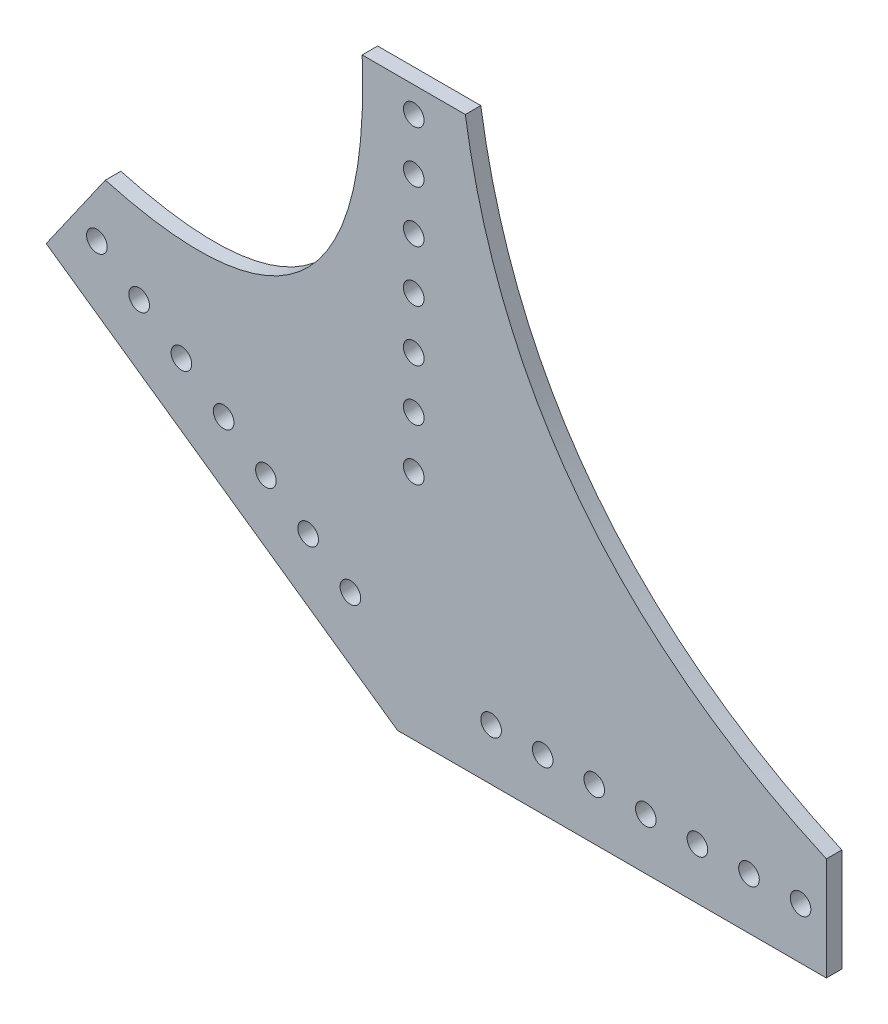
from build123d import *

# Parameters (mm, degrees)
BOSS_EXTRUDE3_DEPTH = 3.81
SKETCH1_7_R         = 2.54
CUT_EXTRUDE6_DEPTH  = 3.81


with BuildPart() as part:
    # Sketch1 → Boss-Extrude3 (new body)
    with BuildSketch(Plane.XY):
        with BuildLine():
            Line((-103.210268441, 60.572134971), (-88.641426958, 81.378596896))
            add(Edge.make_bspline(
                [(-88.641426958, 81.378596896), (-22.41304359, 63.036283333), (-25.4, 139.7)],
                knots=[0, 0, 0, 1, 1, 1], degree=2))
            Line((-25.4, 139.7), (0, 139.7))
            add(Edge.make_bspline(
                [(0, 139.7), (12.336045518, 59.79590729), (88.9, 25.4)],
                knots=[0, 0, 0, 1, 1, 1], degree=2))
            Line((88.9, 25.4), (88.9, 0))
            Line((88.9, 0), (-16.704294619, 0))
            Line((-16.704294619, 0), (-103.210268441, 60.572134971))
        make_face()
    extrude(amount=BOSS_EXTRUDE3_DEPTH)

    # Sketch1<7> → Cut-Extrude6 (cut)
    with BuildSketch(Plane.XY):
        with Locations((-12.7, 57.15)):
            Circle(SKETCH1_7_R)
        with Locations((-12.7, 69.85)):
            Circle(SKETCH1_7_R)
        with Locations((-12.7, 82.55)):
            Circle(SKETCH1_7_R)
        with Locations((-12.7, 95.25)):
            Circle(SKETCH1_7_R)
        with Locations((-12.7, 107.95)):
            Circle(SKETCH1_7_R)
        with Locations((-12.7, 120.65)):
            Circle(SKETCH1_7_R)
        with Locations((-12.7, 133.35)):
            Circle(SKETCH1_7_R)
        with Locations((6.35, 12.7)):
            Circle(SKETCH1_7_R)
        with Locations((19.05, 12.7)):
            Circle(SKETCH1_7_R)
        with Locations((31.75, 12.7)):
            Circle(SKETCH1_7_R)
        with Locations((44.45, 12.7)):
            Circle(SKETCH1_7_R)
        with Locations((57.15, 12.7)):
            Circle(SKETCH1_7_R)
        with Locations((69.85, 12.7)):
            Circle(SKETCH1_7_R)
        with Locations((82.55, 12.7)):
            Circle(SKETCH1_7_R)
        with Locations((-28.304846444, 23.626631112)):
            Circle(SKETCH1_7_R)
        with Locations((-38.708077406, 30.911051854)):
            Circle(SKETCH1_7_R)
        with Locations((-49.111308369, 38.195472596)):
            Circle(SKETCH1_7_R)
        with Locations((-59.514539331, 45.479893337)):
            Circle(SKETCH1_7_R)
        with Locations((-69.917770294, 52.764314079)):
            Circle(SKETCH1_7_R)
        with Locations((-80.321001256, 60.048734821)):
            Circle(SKETCH1_7_R)
        with Locations((-90.724232219, 67.333155562)):
            Circle(SKETCH1_7_R)
    extrude(amount=CUT_EXTRUDE6_DEPTH, mode=Mode.SUBTRACT)


solid = part.part
